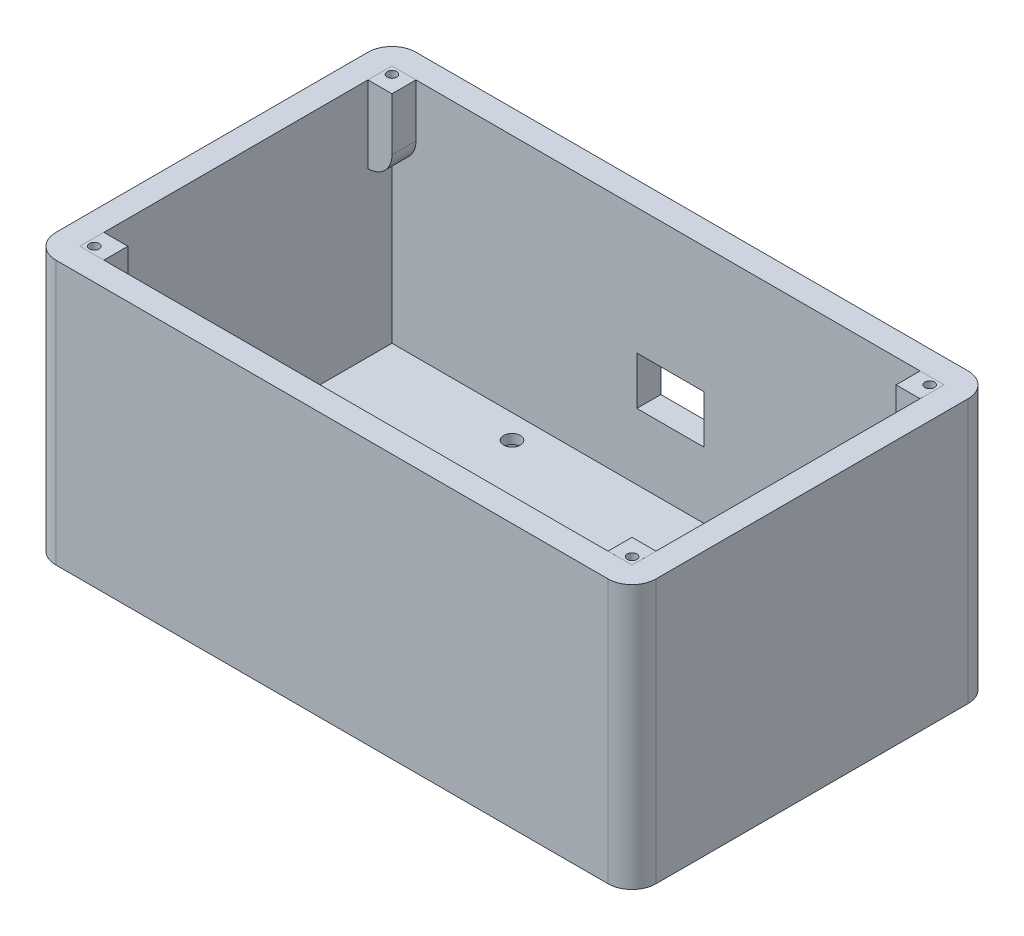
from build123d import *

# Parameters (mm, degrees)
CROQUIS1_W                        = 125
CROQUIS1_H                        = 75
CROQUIS1_W_2                      = 115
CROQUIS1_H_2                      = 65
SALIENTE_EXTRUIR1_DEPTH           = 50
CROQUIS2_W                        = 125
CROQUIS2_H                        = 75
SALIENTE_EXTRUIR2_DEPTH           = 5
REDONDEO1_R                       = 5
SALIENTE_EXTRUIR3_DEPTH           = 10
CORTAR_EXTRUIR1_DEPTH             = 8
CROQUIS6_R                        = 1.75
CORTAR_EXTRUIR4_DEPTH             = 2
CORTAR_EXTRUIR5_DEPTH             = 5
SALIENTE_EXTRUIR4_DEPTH           = 0.001
SALIENTE_EXTRUIR4_DEPTH_BACK      = 16
CROQUIS8_W                        = 5
CROQUIS8_H                        = 5
REDONDEO2_R                       = 5
DI_METRO_DE_TALADRO_2_0_2_4_D     = 2
DI_METRO_DE_TALADRO_2_0_2_4_DEPTH = 10
DI_METRO_DE_TALADRO_2_0_2_4_TIP   = 0.600860619
CROQUIS11_R                       = 2.5
SALIENTE_EXTRUIR5_DEPTH           = 4
CROQUIS13_R                       = 1.5
CORTAR_EXTRUIR6_DEPTH             = 9
CORTAR_EXTRUIR7_DEPTH             = 3.2


with BuildPart() as part:
    # Croquis1 → Saliente-Extruir1 (new body)
    with BuildSketch(Plane(origin=(0, 0, 0), x_dir=(1, 0, 0), z_dir=(0, 1, 0))):
        Rectangle(CROQUIS1_W, CROQUIS1_H)
        Rectangle(CROQUIS1_W_2, CROQUIS1_H_2, mode=Mode.SUBTRACT)
    extrude(amount=SALIENTE_EXTRUIR1_DEPTH)

    # Croquis2 → Saliente-Extruir2 (add)
    with BuildSketch(Plane.XZ):
        Rectangle(CROQUIS2_W, CROQUIS2_H)
    extrude(amount=SALIENTE_EXTRUIR2_DEPTH)

    # Redondeo1
    redondeo1_edges = [part.edges().sort_by_distance(p)[0] for p in [
        (62.5, 22.5, 37.5),
        (-62.5, 22.5, 37.5),
        (-62.5, 22.5, -37.5),
        (62.5, 22.5, -37.5),
    ]]
    fillet(redondeo1_edges, radius=REDONDEO1_R)

    # Croquis3 → Saliente-Extruir3 (add)
    with BuildSketch(Plane(origin=(0, 0, 0), x_dir=(1, 0, 0), z_dir=(0, 1, 0))):
        Polygon((53.5, 24.151368439), (56.4, 25.825684219), (56.4, 29.174315781), (53.5, 30.848631561), (50.6, 29.174315781), (50.6, 25.825684219), align=None)
        Polygon((-24.6, 25.825684219), (-27.5, 24.151368439), (-30.4, 25.825684219), (-30.4, 29.174315781), (-27.5, 30.848631561), (-24.6, 29.174315781), align=None)
        Polygon((-24.6, -16.174315781), (-24.6, -12.825684219), (-27.5, -11.151368439), (-30.4, -12.825684219), (-30.4, -16.174315781), (-27.5, -17.848631561), align=None)
        Polygon((50.6, -12.825684219), (53.5, -11.151368439), (56.4, -12.825684219), (56.4, -16.174315781), (53.5, -17.848631561), (50.6, -16.174315781), align=None)
    extrude(amount=-SALIENTE_EXTRUIR3_DEPTH)

    # Croquis4 → Cortar-Extruir1 (cut)
    with BuildSketch(Plane.XZ.offset(10)):
        Polygon((53.5, -24.151368439), (50.6, -25.825684219), (50.6, -29.174315781), (53.5, -30.848631561), (56.4, -29.174315781), (56.4, -25.825684219), align=None)
        Polygon((50.6, 16.174315781), (50.6, 12.825684219), (53.5, 11.151368439), (56.4, 12.825684219), (56.4, 16.174315781), (53.5, 17.848631561), align=None)
        Polygon((-24.6, 16.174315781), (-27.5, 17.848631561), (-30.4, 16.174315781), (-30.4, 12.825684219), (-27.5, 11.151368439), (-24.6, 12.825684219), align=None)
        Polygon((-24.6, -29.174315781), (-24.6, -25.825684219), (-27.5, -24.151368439), (-30.4, -25.825684219), (-30.4, -29.174315781), (-27.5, -30.848631561), align=None)
    extrude(amount=-CORTAR_EXTRUIR1_DEPTH, mode=Mode.SUBTRACT)

    # Croquis6 → Cortar-Extruir4 (cut)
    with BuildSketch(Plane.XZ.offset(2)):
        with Locations(Location((53.5, -27.5, 0), (0, 0, 270))):
            Circle(CROQUIS6_R)
        with Locations(Location((-27.5, -27.5, 0), (0, 0, 270))):
            Circle(CROQUIS6_R)
        with Locations(Location((-27.5, 14.5, 0), (0, 0, 270))):
            Circle(CROQUIS6_R)
        with Locations(Location((53.5, 14.5, 0), (0, 0, 270))):
            Circle(CROQUIS6_R)
    extrude(amount=-CORTAR_EXTRUIR4_DEPTH, mode=Mode.SUBTRACT)

    # Croquis7 → Cortar-Extruir5 (cut)
    with BuildSketch(Plane.XY.offset(-32.5)):
        Polygon((-3.928571429, 23.75), (7.5, 23.75), (7.5, 13.75), (-5.131578947, 13.75), (-6.5, 13.75), (-6.5, 23.75), align=None)
    extrude(amount=-CORTAR_EXTRUIR5_DEPTH, mode=Mode.SUBTRACT)

    # Croquis8 → Saliente-Extruir4 (add, two sides: drawn at the far end of the back side and taken through both)
    with BuildSketch(Plane(origin=(0, 50, 0), x_dir=(1, 0, 0), z_dir=(0, 1, 0)).offset(-SALIENTE_EXTRUIR4_DEPTH_BACK)):
        with Locations((-55, -30)):
            Rectangle(CROQUIS8_W, CROQUIS8_H)
        with Locations((55, -30)):
            Rectangle(CROQUIS8_W, CROQUIS8_H)
        with Locations((55, 30)):
            Rectangle(CROQUIS8_W, CROQUIS8_H)
        with Locations((-55, 30)):
            Rectangle(CROQUIS8_W, CROQUIS8_H)
    extrude(amount=SALIENTE_EXTRUIR4_DEPTH + SALIENTE_EXTRUIR4_DEPTH_BACK)

    # Redondeo2
    redondeo2_edges = [part.edges().sort_by_distance(p)[0] for p in [
        (-52.5, 34, -30),
        (-52.5, 34, 30),
        (52.5, 34, 30),
        (52.5, 34, -30),
    ]]
    fillet(redondeo2_edges, radius=REDONDEO2_R - 0.0001)  # a hair under: the kernel refuses the full size

    # Diámetro de taladro Ø2.0 (2)4
    with Locations(Plane(origin=(-56, 50.001, -31), x_dir=(0, 0, 1), z_dir=(0, 1, 0))):
        with Locations((0, 0), (0, 112), (62, 112), (62, 0)):
            Hole(DI_METRO_DE_TALADRO_2_0_2_4_D / 2, depth=DI_METRO_DE_TALADRO_2_0_2_4_DEPTH)
            with Locations((0, 0, -(DI_METRO_DE_TALADRO_2_0_2_4_DEPTH + DI_METRO_DE_TALADRO_2_0_2_4_TIP / 2))):  # 118° drill point
                Cone(0, DI_METRO_DE_TALADRO_2_0_2_4_D / 2, DI_METRO_DE_TALADRO_2_0_2_4_TIP, mode=Mode.SUBTRACT)

    # Croquis11 → Saliente-Extruir5 (add)
    with BuildSketch(Plane(origin=(0, 0, 0), x_dir=(1, 0, 0), z_dir=(0, 1, 0))):
        with Locations(Location((12.5, -24, 0), (0, 0, 270))):
            Circle(CROQUIS11_R)
        with Locations(Location((48.5, -24, 0), (0, 0, 270))):
            Circle(CROQUIS11_R)
    extrude(amount=SALIENTE_EXTRUIR5_DEPTH)

    # Croquis13 → Cortar-Extruir6 (cut)
    with BuildSketch(Plane(origin=(0, 4, 0), x_dir=(1, 0, 0), z_dir=(0, 1, 0))):
        with Locations(Location((12.5, -24, 0), (0, 0, 270))):
            Circle(CROQUIS13_R)
        with Locations(Location((48.5, -24, 0), (0, 0, 270))):
            Circle(CROQUIS13_R)
    extrude(amount=-CORTAR_EXTRUIR6_DEPTH, mode=Mode.SUBTRACT)

    # Croquis14 → Cortar-Extruir7 (cut)
    with BuildSketch(Plane.XZ.offset(5)):
        Polygon((12.5, 20.651368439), (15.4, 22.325684219), (15.4, 25.674315781), (12.5, 27.348631561), (9.6, 25.674315781), (9.6, 22.325684219), align=None)
        Polygon((48.5, 20.651368439), (51.4, 22.325684219), (51.4, 25.674315781), (48.5, 27.348631561), (45.6, 25.674315781), (45.6, 22.325684219), align=None)
    extrude(amount=-CORTAR_EXTRUIR7_DEPTH, mode=Mode.SUBTRACT)


solid = part.part
